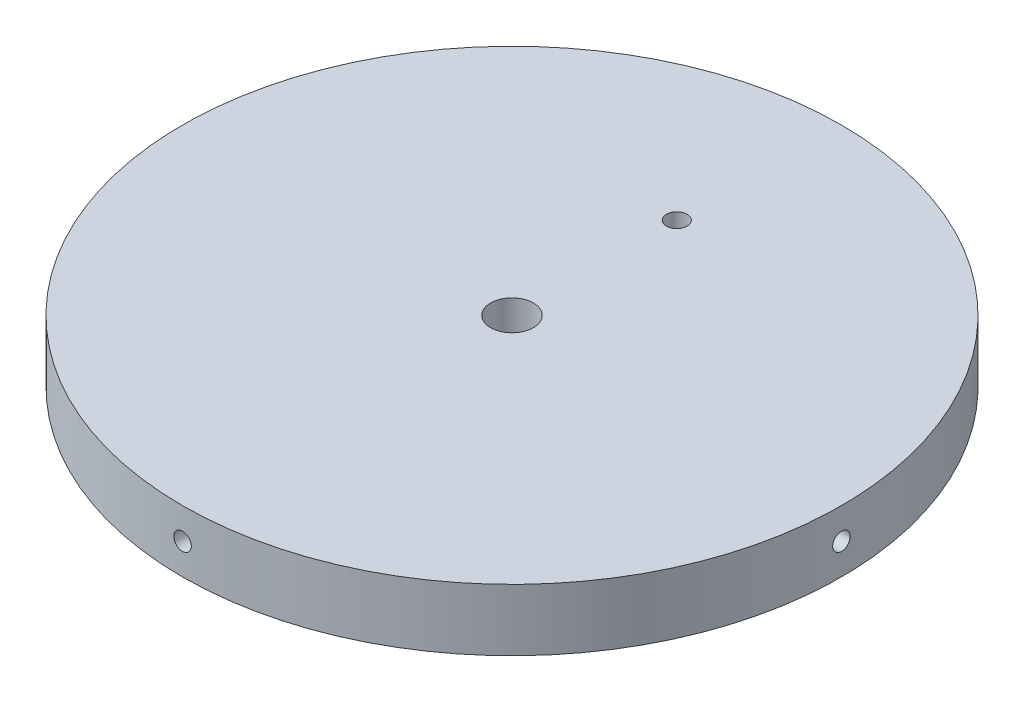
from build123d import *

# Parameters (mm, degrees)
SKETCH1_R           = 50.8
SKETCH1_R_2         = 3.3
SKETCH1_R_3         = 1.5875
BOSS_EXTRUDE1_DEPTH = 4.7625
SKETCH2_R           = 1.35255
CUT_EXTRUDE1_DEPTH  = 12.7
CIRPATTERN1_COUNT   = 4


with BuildPart() as part:
    # Sketch1 → Boss-Extrude1 (new, symmetric)
    with BuildSketch(Plane(origin=(0, 0, 0), x_dir=(1, 0, 0), z_dir=(0, 1, 0))):
        Circle(SKETCH1_R)
        Circle(SKETCH1_R_2, mode=Mode.SUBTRACT)
        with Locations((0, 25.4)):
            Circle(SKETCH1_R_3, mode=Mode.SUBTRACT)
    extrude(amount=BOSS_EXTRUDE1_DEPTH, both=True)

    # Sketch2 → Cut-Extrude1 (cut)
    with BuildSketch(Plane.XY.offset(50.8)):
        Circle(SKETCH2_R)
    cut_extrude1 = extrude(amount=-CUT_EXTRUDE1_DEPTH, mode=Mode.SUBTRACT)

    # CirPattern1: Cut-Extrude1 ×4 about axis
    cirpattern1_axis = Axis((0, 4.7625, 0), (0, -1, 0))
    for i in range(1, CIRPATTERN1_COUNT):
        add(cut_extrude1.rotate(cirpattern1_axis, i * 360 / CIRPATTERN1_COUNT), mode=Mode.SUBTRACT)


solid = part.part
